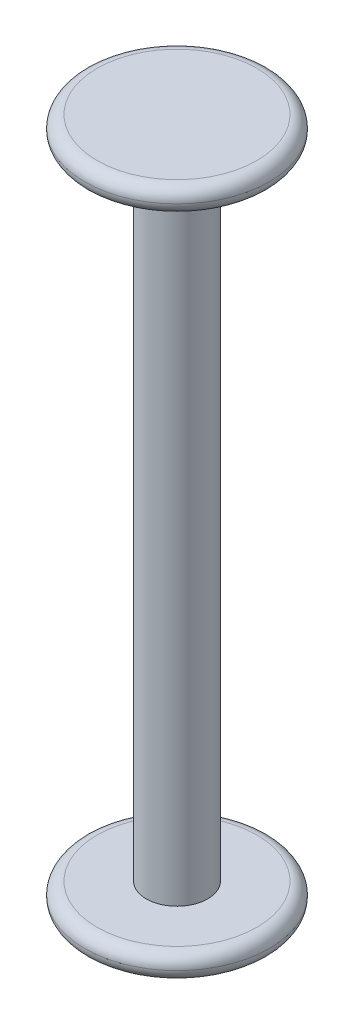
from build123d import *

# Parameters (mm, degrees)
SKETCH1_R           = 2.5
BOSS_EXTRUDE1_DEPTH = 26
SKETCH2_R           = 7.5
BOSS_EXTRUDE2_DEPTH = 2
FILLET1_R           = 1


with BuildPart() as part:
    # Sketch1 → Boss-Extrude1 (new body)
    with BuildSketch(Plane(origin=(0, 0, 0), x_dir=(1, 0, 0), z_dir=(0, 1, 0))):
        with Locations(Location((0, 0, 0), (0, 0, 90))):
            Circle(SKETCH1_R)
    extrude(amount=BOSS_EXTRUDE1_DEPTH)

    # Sketch2 → Boss-Extrude2 (add)
    with BuildSketch(Plane(origin=(0, 26, 0), x_dir=(1, 0, 0), z_dir=(0, 1, 0))):
        with Locations(Location((0, 0, 0), (0, 0, 270))):
            Circle(SKETCH2_R)
    extrude(amount=BOSS_EXTRUDE2_DEPTH)

    # Fillet1
    fillet1_edges = [part.edges().sort_by_distance(p)[0] for p in [
        (0, 26, -7.5),
        (0, 28, -7.5),
    ]]
    fillet(fillet1_edges, radius=FILLET1_R - 0.0001)  # a hair under: the kernel refuses the full size

    # Mirror1: part across plane


with BuildPart() as part_1:
    add(part.part)
    add(part.part.mirror(Plane.ZX))


solid = part_1.part
